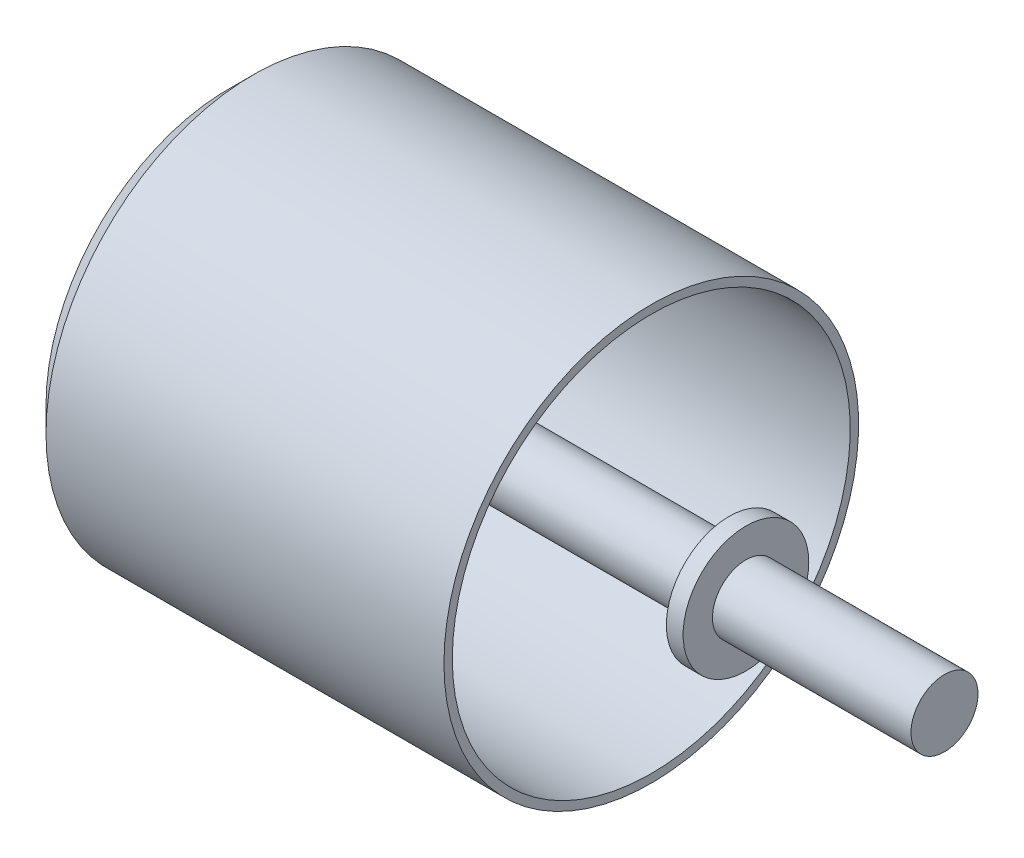
from build123d import *

# Parameters (mm, degrees)
SKETCH2_R           = 4
BOSS_EXTRUDE1_DEPTH = 85.5
SKETCH3_R           = 3.5
CUT_EXTRUDE1_DEPTH  = 93.387093254
SKETCH4_R           = 7.5
BOSS_EXTRUDE2_DEPTH = 2


with BuildPart() as part:
    # Sketch1 → Revolve1 (revolve)
    with BuildSketch(Plane.XY):
        Polygon((0, 21.75), (3, 24.75), (50.5, 24.75), (50.5, 23.75), (3.414213562, 23.75), (1, 21.335786438), (1, 0), (0, 0), align=None)
    revolve(axis=Axis((0, 0, 0), (1, 0, 0)))

    # Sketch2 → Boss-Extrude1 (add)
    with BuildSketch(Plane(origin=(0, 0, 0), x_dir=(0, 0, -1), z_dir=(1, 0, 0))):
        Circle(SKETCH2_R)
    extrude(amount=BOSS_EXTRUDE1_DEPTH)

    # Sketch3 → Cut-Extrude1 (cut, through all)
    with BuildSketch(Plane.ZY):
        with Locations((0, 17)):
            Circle(SKETCH3_R)
        with Locations((17, 0)):
            Circle(SKETCH3_R)
        with Locations((0, -17)):
            Circle(SKETCH3_R)
        with Locations((-17, 0)):
            Circle(SKETCH3_R)
    extrude(amount=-CUT_EXTRUDE1_DEPTH, mode=Mode.SUBTRACT)

    # Sketch4 → Boss-Extrude2 (add)
    with BuildSketch(Plane(origin=(59.8, 0, 0), x_dir=(0, 0, -1), z_dir=(1, 0, 0))):
        Circle(SKETCH4_R)
    extrude(amount=BOSS_EXTRUDE2_DEPTH)


solid = part.part
